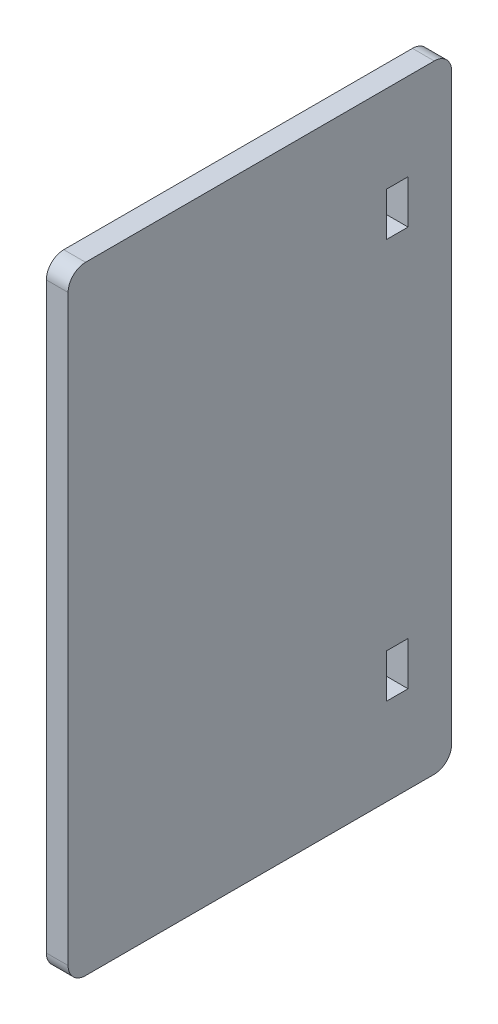
from build123d import *

# Parameters (mm, degrees)
SKETCH1_W           = 55.875
SKETCH1_H           = 90
BOSS_EXTRUDE1_DEPTH = 3.175
SKETCH2_W           = 3.175
SKETCH2_H           = 6.35
CUT_EXTRUDE1_DEPTH  = 54.062081859
FILLET1_R           = 2.54


with BuildPart() as part:
    # Sketch1 → Boss-Extrude1 (new body)
    with BuildSketch(Plane(origin=(0, 0, 0), x_dir=(0, 0, -1), z_dir=(1, 0, 0))):
        Rectangle(SKETCH1_W, SKETCH1_H)
    extrude(amount=BOSS_EXTRUDE1_DEPTH)

    # Sketch2 → Cut-Extrude1 (cut, through all)
    with BuildSketch(Plane(origin=(3.175, 0, 0), x_dir=(0, 0, -1), z_dir=(1, 0, 0))):
        with Locations((20, 29.125)):
            Rectangle(SKETCH2_W, SKETCH2_H)
        with Locations((20, -29.125)):
            Rectangle(SKETCH2_W, SKETCH2_H)
    extrude(amount=-CUT_EXTRUDE1_DEPTH, mode=Mode.SUBTRACT)

    # Fillet1
    fillet1_edges = [part.edges().sort_by_distance(p)[0] for p in [
        (1.5875, -45, 27.9375),
        (1.5875, -45, -27.9375),
        (1.5875, 45, -27.9375),
        (1.5875, 45, 27.9375),
    ]]
    fillet(fillet1_edges, radius=FILLET1_R)


solid = part.part
